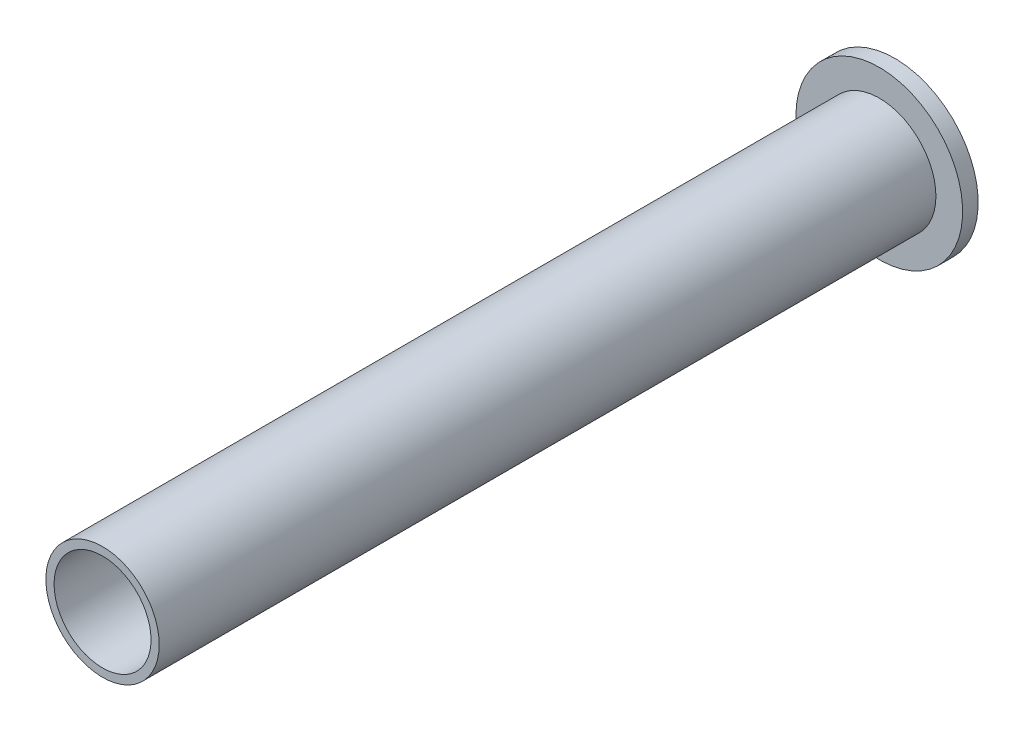
from build123d import *
from build123d.topology import SkipClean

# Parameters (mm, degrees)
SKETCH1_R           = 18.231227921
SKETCH1_R_2         = 15.603082618
BOSS_EXTRUDE1_DEPTH = 250
BOSS_EXTRUDE2_START = 5
SKETCH2_R           = 26.826451441
SKETCH2_R_2         = 15.603082618
BOSS_EXTRUDE2_DEPTH = 5


with BuildPart() as part:
    # Sketch1 → Boss-Extrude1 (new body)
    with BuildSketch(Plane.XY):
        Circle(SKETCH1_R)
        Circle(SKETCH1_R_2, mode=Mode.SUBTRACT)
    extrude(amount=BOSS_EXTRUDE1_DEPTH)

    # Sketch2 → Boss-Extrude2 (add)
    with SkipClean():  # the faces are left unmerged after this step: merging them gives an invalid solid
        with BuildSketch(Plane(origin=(0, 0, 0), x_dir=(-1, 0, 0), z_dir=(0, 0, -1)).offset(BOSS_EXTRUDE2_START)):
            Circle(SKETCH2_R)
            Circle(SKETCH2_R_2, mode=Mode.SUBTRACT)
        extrude(amount=-BOSS_EXTRUDE2_DEPTH)


solid = part.part
